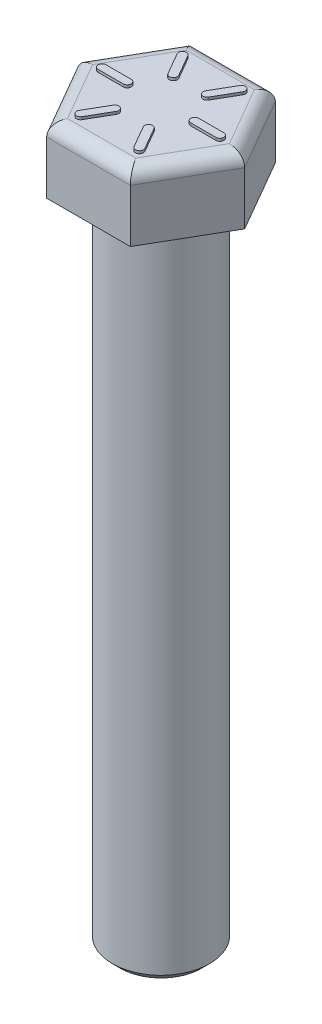
from build123d import *

# Parameters (mm, degrees)
SKETCH1_R           = 4.6609
BOSS_EXTRUDE1_DEPTH = 63.5
BOSS_EXTRUDE2_DEPTH = 6.35
FILLET1_R           = 1.27
CHAMFER1_SIZE       = 0.762
BOSS_EXTRUDE3_DEPTH = 0.254


with BuildPart() as part:
    # Sketch1 → Boss-Extrude1 (new body)
    with BuildSketch(Plane(origin=(0, 0, 0), x_dir=(1, 0, 0), z_dir=(0, 1, 0))):
        Circle(SKETCH1_R)
    extrude(amount=-BOSS_EXTRUDE1_DEPTH)

    # Sketch2 → Boss-Extrude2 (add)
    with BuildSketch(Plane(origin=(0, 0, 0), x_dir=(1, 0, 0), z_dir=(0, 1, 0))):
        Polygon((8.028921518, 0), (4.014460759, 6.95325), (-4.014460759, 6.95325), (-8.028921518, 0), (-4.014460759, -6.95325), (4.014460759, -6.95325), align=None)
    extrude(amount=BOSS_EXTRUDE2_DEPTH)

    # Fillet1
    fillet1_edges = [part.edges().sort_by_distance(p)[0] for p in [
        (0, 6.35, 6.95325),
        (-6.021691139, 6.35, 3.476625),
        (-6.021691139, 6.35, -3.476625),
        (0, 6.35, -6.95325),
        (6.021691139, 6.35, -3.476625),
        (6.021691139, 6.35, 3.476625),
    ]]
    fillet(fillet1_edges, radius=FILLET1_R)

    # Chamfer1
    chamfer1_edges = [part.edges().sort_by_distance(p)[0] for p in [
        (-4.6609, -63.5, 0),
    ]]
    chamfer(chamfer1_edges, length=CHAMFER1_SIZE)

    # Sketch3 → Boss-Extrude3 (add)
    with BuildSketch(Plane(origin=(0, 6.35, 0), x_dir=(1, 0, 0), z_dir=(0, 1, 0))):
        with BuildLine():
            Line((5.6515, -0.381), (3.2385, -0.381))
            ThreePointArc((3.2385, -0.381), (2.8575, 0), (3.2385, 0.381))
            Line((3.2385, 0.381), (5.6515, 0.381))
            ThreePointArc((5.6515, 0.381), (6.0325, 0), (5.6515, -0.381))
        make_face()
        with BuildLine():
            Line((3.155705679, 4.703842569), (1.949205679, 2.61412327))
            ThreePointArc((1.949205679, 2.61412327), (1.42875, 2.474667591), (1.289294321, 2.99512327))
            Line((1.289294321, 2.99512327), (2.495794321, 5.084842569))
            ThreePointArc((2.495794321, 5.084842569), (3.01625, 5.224298248), (3.155705679, 4.703842569))
        make_face()
        with BuildLine():
            Line((-2.495794321, 5.084842569), (-1.289294321, 2.99512327))
            ThreePointArc((-1.289294321, 2.99512327), (-1.42875, 2.474667591), (-1.949205679, 2.61412327))
            Line((-1.949205679, 2.61412327), (-3.155705679, 4.703842569))
            ThreePointArc((-3.155705679, 4.703842569), (-3.01625, 5.224298248), (-2.495794321, 5.084842569))
        make_face()
        with BuildLine():
            Line((-5.6515, 0.381), (-3.2385, 0.381))
            ThreePointArc((-3.2385, 0.381), (-2.8575, 0), (-3.2385, -0.381))
            Line((-3.2385, -0.381), (-5.6515, -0.381))
            ThreePointArc((-5.6515, -0.381), (-6.0325, 0), (-5.6515, 0.381))
        make_face()
        with BuildLine():
            Line((-3.155705679, -4.703842569), (-1.949205679, -2.61412327))
            ThreePointArc((-1.949205679, -2.61412327), (-1.42875, -2.474667591), (-1.289294321, -2.99512327))
            Line((-1.289294321, -2.99512327), (-2.495794321, -5.084842569))
            ThreePointArc((-2.495794321, -5.084842569), (-3.01625, -5.224298248), (-3.155705679, -4.703842569))
        make_face()
        with BuildLine():
            Line((2.495794321, -5.084842569), (1.289294321, -2.99512327))
            ThreePointArc((1.289294321, -2.99512327), (1.42875, -2.474667591), (1.949205679, -2.61412327))
            Line((1.949205679, -2.61412327), (3.155705679, -4.703842569))
            ThreePointArc((3.155705679, -4.703842569), (3.01625, -5.224298248), (2.495794321, -5.084842569))
        make_face()
    extrude(amount=BOSS_EXTRUDE3_DEPTH)


solid = part.part
